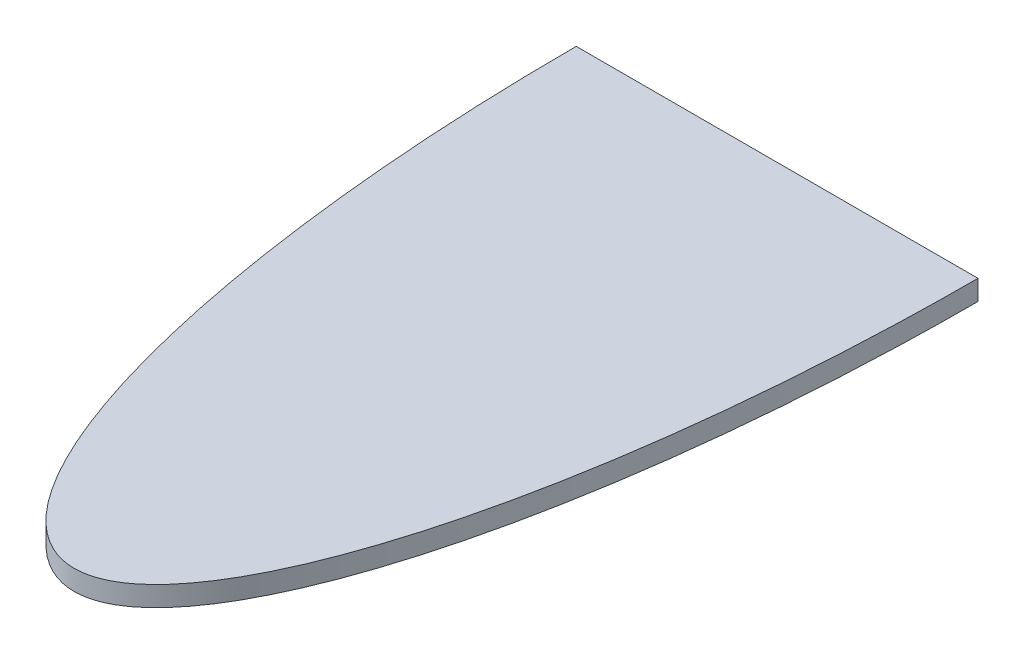
from build123d import *

# Parameters (mm, degrees)
BOSS_EXTRUDE1_DEPTH = 2.54


with BuildPart() as part:
    # Sketch1 → Boss-Extrude1 (new body)
    with BuildSketch(Plane(origin=(0, 0, 0), x_dir=(1, 0, 0), z_dir=(0, 1, 0))):
        with BuildLine():
            add(Edge.make_bspline(
                [(-25.4, 0), (-25.4, -88.9), (0, -88.9)],
                knots=[1.570796327, 1.570796327, 1.570796327, 3.141592654, 3.141592654, 3.141592654], degree=2, weights=[1, 0.707106781, 1]))
            add(Edge.make_bspline(
                [(0, -88.9), (25.4, -88.9), (25.4, 0)],
                knots=[3.141592654, 3.141592654, 3.141592654, 4.71238898, 4.71238898, 4.71238898], degree=2, weights=[1, 0.707106781, 1]))
            Line((25.4, 0), (-25.4, 0))
        make_face()
    extrude(amount=BOSS_EXTRUDE1_DEPTH)


solid = part.part
